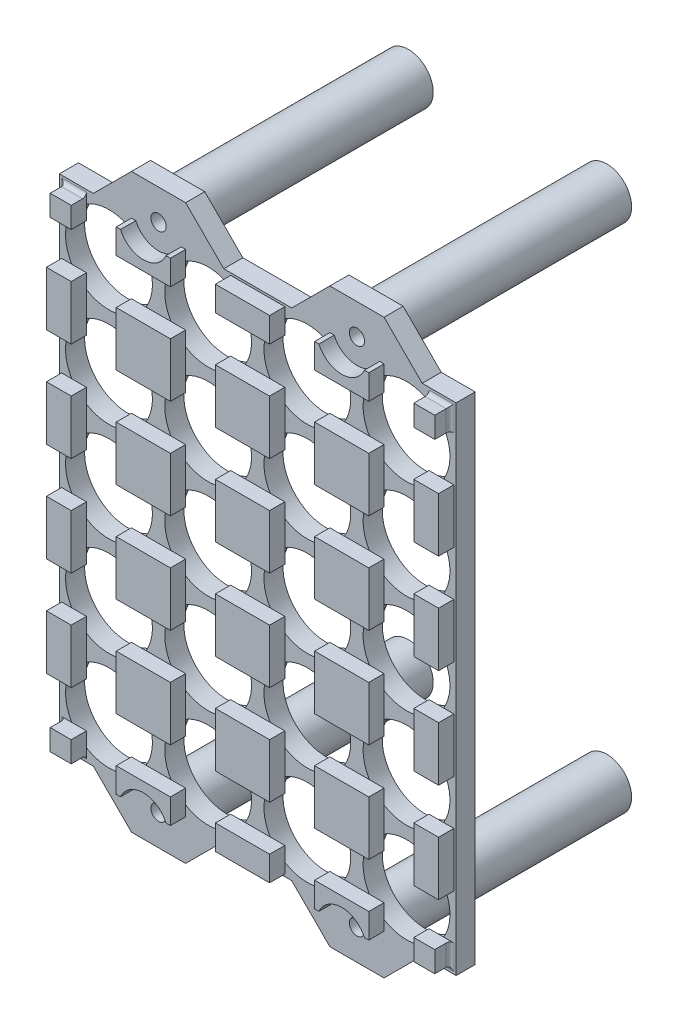
from build123d import *
from build123d.topology import SkipClean

# Parameters (mm, degrees)
SZKIC1_W                         = 104
SZKIC1_H                         = 26
SZKIC1_R                         = 11.376078461
DODANIE_WYCI_GNI_CIE1_DEPTH      = 5
DODANIE_WYCI_GNI_CIE7_START      = 5
SZKIC15_W                        = 5.5
SZKIC15_H                        = 5.5
DODANIE_WYCI_GNI_CIE7_DEPTH      = 4
ZAOKR_GLENIE9_R                  = 1
SZYK_LINIOWY9_COUNT              = 5
SZYK_LINIOWY9_PITCH              = 26
ZAOKR_GLENIE9_OF_SZYK_LINIOWY9_R = 1
SZKIC16_W                        = 14.2
SZKIC16_H                        = 14.2
SZKIC16_H_2                      = 6.5
SZKIC16_W_2                      = 6.5
DODANIE_WYCI_GNI_CIE8_DEPTH      = 4
SZKIC17_W                        = 14.2
SZKIC17_H                        = 5
DODANIE_WYCI_GNI_CIE9_DEPTH      = 10
SZKIC19_R                        = 6.5
SZKIC19_R_2                      = 2
DODANIE_WYCI_GNI_CIE10_DEPTH     = 60.5
WYTNIJ_WYCI_GNI_CIE2_START       = -10
SZKIC19_4_R                      = 2
WYTNIJ_WYCI_GNI_CIE2_DEPTH       = 10
WYTNIJ_WYCI_GNI_CIE4_START       = -15
SZKIC19_6_R                      = 6.5
WYTNIJ_WYCI_GNI_CIE4_DEPTH       = 10
SFAZOWANIE2_SIZE                 = 10
SFAZOWANIE3_SIZE                 = 10


with BuildPart() as part:
    # Szkic1 → Dodanie-wyciągnięcie1 (new body)
    with BuildSketch(Plane.XY):
        with Locations((31.794588102, -4.944794966)):
            Rectangle(SZKIC1_W, SZKIC1_H)
        with Locations((-7.205411898, -4.944794966)):
            Circle(SZKIC1_R, mode=Mode.SUBTRACT)
        with Locations((18.794588102, -4.944794966)):
            Circle(SZKIC1_R, mode=Mode.SUBTRACT)
        with Locations((44.794588102, -4.944794966)):
            Circle(SZKIC1_R, mode=Mode.SUBTRACT)
        with Locations((70.794588102, -4.944794966)):
            Circle(SZKIC1_R, mode=Mode.SUBTRACT)
    dodanie_wyci_gni_cie1 = extrude(amount=DODANIE_WYCI_GNI_CIE1_DEPTH)

    # Szkic15 → Dodanie-wyciągnięcie7 (add)
    with BuildSketch(Plane.XY.offset(DODANIE_WYCI_GNI_CIE7_START)):
        with Locations((-15.855411898, 3.705205034)):
            Rectangle(SZKIC15_W, SZKIC15_H)
        with Locations((1.444588102, 3.705205034)):
            Rectangle(SZKIC15_W, SZKIC15_H)
        with Locations((10.144588102, 3.705205034)):
            Rectangle(SZKIC15_W, SZKIC15_H)
        with Locations((27.444588102, 3.705205034)):
            Rectangle(SZKIC15_W, SZKIC15_H)
        with Locations((36.144588102, 3.705205034)):
            Rectangle(SZKIC15_W, SZKIC15_H)
        with Locations((53.444588102, 3.705205034)):
            Rectangle(SZKIC15_W, SZKIC15_H)
        with Locations((62.144588102, 3.705205034)):
            Rectangle(SZKIC15_W, SZKIC15_H)
        with Locations((79.444588102, 3.705205034)):
            Rectangle(SZKIC15_W, SZKIC15_H)
        with Locations((79.444588102, -13.594794966)):
            Rectangle(SZKIC15_W, SZKIC15_H)
        with Locations((62.144588102, -13.594794966)):
            Rectangle(SZKIC15_W, SZKIC15_H)
        with Locations((53.444588102, -13.594794966)):
            Rectangle(SZKIC15_W, SZKIC15_H)
        with Locations((36.144588102, -13.594794966)):
            Rectangle(SZKIC15_W, SZKIC15_H)
        with Locations((27.444588102, -13.594794966)):
            Rectangle(SZKIC15_W, SZKIC15_H)
        with Locations((10.144588102, -13.594794966)):
            Rectangle(SZKIC15_W, SZKIC15_H)
        with Locations((1.444588102, -13.594794966)):
            Rectangle(SZKIC15_W, SZKIC15_H)
        with Locations((-15.855411898, -13.594794966)):
            Rectangle(SZKIC15_W, SZKIC15_H)
    dodanie_wyci_gni_cie7 = extrude(amount=DODANIE_WYCI_GNI_CIE7_DEPTH)

    # Zaokrąglenie9
    zaokr_glenie9_edges = [part.edges().sort_by_distance(p)[0] for p in [
        (10.144588102, 6.455205034, 5),
        (7.394588102, 3.705205034, 5),
        (1.444588102, -16.344794966, 5),
        (4.194588102, -13.594794966, 5),
        (53.444588102, -16.344794966, 5),
        (56.194588102, -13.594794966, 5),
        (79.444588102, 6.455205034, 5),
        (82.194588102, 3.705205034, 5),
        (79.444588102, -16.344794966, 5),
        (82.194588102, -13.594794966, 5),
        (62.144588102, -16.344794966, 5),
        (59.394588102, -13.594794966, 5),
        (62.144588102, 6.455205034, 5),
        (59.394588102, 3.705205034, 5),
        (53.444588102, 6.455205034, 5),
        (56.194588102, 3.705205034, 5),
        (27.444588102, -16.344794966, 5),
        (30.194588102, -13.594794966, 5),
        (-15.855411898, -16.344794966, 5),
        (-18.605411898, -13.594794966, 5),
        (36.144588102, -16.344794966, 5),
        (33.394588102, -13.594794966, 5),
        (36.144588102, 6.455205034, 5),
        (33.394588102, 3.705205034, 5),
        (27.444588102, 6.455205034, 5),
        (30.194588102, 3.705205034, 5),
        (10.144588102, -16.344794966, 5),
        (7.394588102, -13.594794966, 5),
        (-15.855411898, 6.455205034, 5),
        (-18.605411898, 3.705205034, 5),
        (1.444588102, 6.455205034, 5),
        (4.194588102, 3.705205034, 5),
    ]]
    fillet(zaokr_glenie9_edges, radius=ZAOKR_GLENIE9_R)

    # Szyk liniowy9: Dodanie-wyciągnięcie1, Dodanie-wyciągnięcie7 ×5
    with Locations(*[(0, i * SZYK_LINIOWY9_PITCH, 0) for i in range(1, SZYK_LINIOWY9_COUNT)]):
        add(dodanie_wyci_gni_cie1)
        add(dodanie_wyci_gni_cie7)

    # Zaokrąglenie9 of Szyk liniowy9
    zaokr_glenie9_of_szyk_liniowy9_edges = [part.edges().sort_by_distance(p)[0] for p in [
        (10.144588102, 32.455205034, 5),
        (7.394588102, 29.705205034, 5),
        (1.444588102, 9.655205034, 5),
        (4.194588102, 12.405205034, 5),
        (53.444588102, 9.655205034, 5),
        (56.194588102, 12.405205034, 5),
        (79.444588102, 32.455205034, 5),
        (82.194588102, 29.705205034, 5),
        (79.444588102, 9.655205034, 5),
        (82.194588102, 12.405205034, 5),
        (62.144588102, 9.655205034, 5),
        (59.394588102, 12.405205034, 5),
        (62.144588102, 32.455205034, 5),
        (59.394588102, 29.705205034, 5),
        (53.444588102, 32.455205034, 5),
        (56.194588102, 29.705205034, 5),
        (27.444588102, 9.655205034, 5),
        (30.194588102, 12.405205034, 5),
        (-15.855411898, 9.655205034, 5),
        (-18.605411898, 12.405205034, 5),
        (36.144588102, 9.655205034, 5),
        (33.394588102, 12.405205034, 5),
        (36.144588102, 32.455205034, 5),
        (33.394588102, 29.705205034, 5),
        (27.444588102, 32.455205034, 5),
        (30.194588102, 29.705205034, 5),
        (10.144588102, 9.655205034, 5),
        (7.394588102, 12.405205034, 5),
        (-15.855411898, 32.455205034, 5),
        (-18.605411898, 29.705205034, 5),
        (1.444588102, 32.455205034, 5),
        (4.194588102, 29.705205034, 5),
        (10.144588102, 58.455205034, 5),
        (7.394588102, 55.705205034, 5),
        (1.444588102, 35.655205034, 5),
        (4.194588102, 38.405205034, 5),
        (53.444588102, 35.655205034, 5),
        (56.194588102, 38.405205034, 5),
        (79.444588102, 58.455205034, 5),
        (82.194588102, 55.705205034, 5),
        (79.444588102, 35.655205034, 5),
        (82.194588102, 38.405205034, 5),
        (62.144588102, 35.655205034, 5),
        (59.394588102, 38.405205034, 5),
        (62.144588102, 58.455205034, 5),
        (59.394588102, 55.705205034, 5),
        (53.444588102, 58.455205034, 5),
        (56.194588102, 55.705205034, 5),
        (27.444588102, 35.655205034, 5),
        (30.194588102, 38.405205034, 5),
        (-15.855411898, 35.655205034, 5),
        (-18.605411898, 38.405205034, 5),
        (36.144588102, 35.655205034, 5),
        (33.394588102, 38.405205034, 5),
        (36.144588102, 58.455205034, 5),
        (33.394588102, 55.705205034, 5),
        (27.444588102, 58.455205034, 5),
        (30.194588102, 55.705205034, 5),
        (10.144588102, 35.655205034, 5),
        (7.394588102, 38.405205034, 5),
        (-15.855411898, 58.455205034, 5),
        (-18.605411898, 55.705205034, 5),
        (1.444588102, 58.455205034, 5),
        (4.194588102, 55.705205034, 5),
        (10.144588102, 84.455205034, 5),
        (7.394588102, 81.705205034, 5),
        (1.444588102, 61.655205034, 5),
        (4.194588102, 64.405205034, 5),
        (53.444588102, 61.655205034, 5),
        (56.194588102, 64.405205034, 5),
        (79.444588102, 84.455205034, 5),
        (82.194588102, 81.705205034, 5),
        (79.444588102, 61.655205034, 5),
        (82.194588102, 64.405205034, 5),
        (62.144588102, 61.655205034, 5),
        (59.394588102, 64.405205034, 5),
        (62.144588102, 84.455205034, 5),
        (59.394588102, 81.705205034, 5),
        (53.444588102, 84.455205034, 5),
        (56.194588102, 81.705205034, 5),
        (27.444588102, 61.655205034, 5),
        (30.194588102, 64.405205034, 5),
        (-15.855411898, 61.655205034, 5),
        (-18.605411898, 64.405205034, 5),
        (36.144588102, 61.655205034, 5),
        (33.394588102, 64.405205034, 5),
        (36.144588102, 84.455205034, 5),
        (33.394588102, 81.705205034, 5),
        (27.444588102, 84.455205034, 5),
        (30.194588102, 81.705205034, 5),
        (10.144588102, 61.655205034, 5),
        (7.394588102, 64.405205034, 5),
        (-15.855411898, 84.455205034, 5),
        (-18.605411898, 81.705205034, 5),
        (1.444588102, 84.455205034, 5),
        (4.194588102, 81.705205034, 5),
        (10.144588102, 110.455205034, 5),
        (7.394588102, 107.705205034, 5),
        (1.444588102, 87.655205034, 5),
        (4.194588102, 90.405205034, 5),
        (53.444588102, 87.655205034, 5),
        (56.194588102, 90.405205034, 5),
        (79.444588102, 110.455205034, 5),
        (82.194588102, 107.705205034, 5),
        (79.444588102, 87.655205034, 5),
        (82.194588102, 90.405205034, 5),
        (62.144588102, 87.655205034, 5),
        (59.394588102, 90.405205034, 5),
        (62.144588102, 110.455205034, 5),
        (59.394588102, 107.705205034, 5),
        (53.444588102, 110.455205034, 5),
        (56.194588102, 107.705205034, 5),
        (27.444588102, 87.655205034, 5),
        (30.194588102, 90.405205034, 5),
        (-15.855411898, 87.655205034, 5),
        (-18.605411898, 90.405205034, 5),
        (36.144588102, 87.655205034, 5),
        (33.394588102, 90.405205034, 5),
        (36.144588102, 110.455205034, 5),
        (33.394588102, 107.705205034, 5),
        (27.444588102, 110.455205034, 5),
        (30.194588102, 107.705205034, 5),
        (10.144588102, 87.655205034, 5),
        (7.394588102, 90.405205034, 5),
        (-15.855411898, 110.455205034, 5),
        (-18.605411898, 107.705205034, 5),
        (1.444588102, 110.455205034, 5),
        (4.194588102, 107.705205034, 5),
    ]]
    fillet(zaokr_glenie9_of_szyk_liniowy9_edges, radius=ZAOKR_GLENIE9_OF_SZYK_LINIOWY9_R)

    # Szkic16 → Dodanie-wyciągnięcie8 (add)
    with BuildSketch(Plane.XY.offset(5)):
        with Locations((5.794588102, 86.055205034)):
            Rectangle(SZKIC16_W, SZKIC16_H)
        with Locations((31.794588102, 86.055205034)):
            Rectangle(SZKIC16_W, SZKIC16_H)
        with Locations((57.794588102, 86.055205034)):
            Rectangle(SZKIC16_W, SZKIC16_H)
        with Locations((5.794588102, 60.055205034)):
            Rectangle(SZKIC16_W, SZKIC16_H)
        with Locations((31.794588102, 60.055205034)):
            Rectangle(SZKIC16_W, SZKIC16_H)
        with Locations((57.794588102, 60.055205034)):
            Rectangle(SZKIC16_W, SZKIC16_H)
        with Locations((57.794588102, 34.055205034)):
            Rectangle(SZKIC16_W, SZKIC16_H)
        with Locations((31.794588102, 34.055205034)):
            Rectangle(SZKIC16_W, SZKIC16_H)
        with Locations((5.794588102, 34.055205034)):
            Rectangle(SZKIC16_W, SZKIC16_H)
        with Locations((5.794588102, 8.055205034)):
            Rectangle(SZKIC16_W, SZKIC16_H)
        with Locations((31.794588102, 8.055205034)):
            Rectangle(SZKIC16_W, SZKIC16_H)
        with Locations((57.794588102, 8.055205034)):
            Rectangle(SZKIC16_W, SZKIC16_H)
        with Locations((5.794588102, 108.205205034)):
            Rectangle(SZKIC16_W, SZKIC16_H_2)
        with Locations((31.794588102, 108.205205034)):
            Rectangle(SZKIC16_W, SZKIC16_H_2)
        with Locations((57.794588102, 108.205205034)):
            Rectangle(SZKIC16_W, SZKIC16_H_2)
        with Locations((79.944588102, 86.055205034)):
            Rectangle(SZKIC16_W_2, SZKIC16_H)
        with Locations((79.944588102, 60.055205034)):
            Rectangle(SZKIC16_W_2, SZKIC16_H)
        with Locations((79.944588102, 34.055205034)):
            Rectangle(SZKIC16_W_2, SZKIC16_H)
        with Locations((79.944588102, 8.055205034)):
            Rectangle(SZKIC16_W_2, SZKIC16_H)
        with Locations((57.794588102, -14.094794966)):
            Rectangle(SZKIC16_W, SZKIC16_H_2)
        with Locations((31.794588102, -14.094794966)):
            Rectangle(SZKIC16_W, SZKIC16_H_2)
        with Locations((5.794588102, -14.094794966)):
            Rectangle(SZKIC16_W, SZKIC16_H_2)
        with Locations((-16.355411898, 8.055205034)):
            Rectangle(SZKIC16_W_2, SZKIC16_H)
        with Locations((-16.355411898, 34.055205034)):
            Rectangle(SZKIC16_W_2, SZKIC16_H)
        with Locations((-16.355411898, 60.055205034)):
            Rectangle(SZKIC16_W_2, SZKIC16_H)
        with Locations((-16.355411898, 86.055205034)):
            Rectangle(SZKIC16_W_2, SZKIC16_H)
    extrude(amount=DODANIE_WYCI_GNI_CIE8_DEPTH)

    # Szkic17 → Dodanie-wyciągnięcie9 (add)
    with BuildSketch(Plane(origin=(0, 112.055205034, 0), x_dir=(1, 0, 0), z_dir=(0, 1, 0))):
        with Locations((5.794588102, -2.5)):
            Rectangle(SZKIC17_W, SZKIC17_H)
        with Locations((57.794588102, -2.5)):
            Rectangle(SZKIC17_W, SZKIC17_H)
    dodanie_wyci_gni_cie9 = extrude(amount=DODANIE_WYCI_GNI_CIE9_DEPTH)

    # Szkic19 → Dodanie-wyciągnięcie10 (add)
    # profile 1 of 5: a face of its own
    with BuildSketch(Plane(origin=(0, 0, 0), x_dir=(-1, 0, 0), z_dir=(0, 0, -1))):
        with BuildLine():
            ThreePointArc((-51.294588102, 114.055205034), (-53.198394025, 118.651399111), (-57.794588102, 120.555205034))
            Line((-57.794588102, 120.555205034), (-57.794588102, 116.055205034))
            ThreePointArc((-57.794588102, 116.055205034), (-56.38037454, 115.469418596), (-55.794588102, 114.055205034))
            ThreePointArc((-55.794588102, 114.055205034), (-56.38037454, 112.640991471), (-57.794588102, 112.055205034))
            Line((-57.794588102, 112.055205034), (-57.794588102, 107.555205034))
            ThreePointArc((-57.794588102, 107.555205034), (-53.198394025, 109.459010956), (-51.294588102, 114.055205034))
        make_face()
    # profile 2 of 5: a face of its own
    with BuildSketch(Plane(origin=(0, 0, 0), x_dir=(-1, 0, 0), z_dir=(0, 0, -1))):
        with BuildLine():
            Line((-57.794588102, 116.055205034), (-57.794588102, 120.555205034))
            ThreePointArc((-57.794588102, 120.555205034), (-64.294588102, 114.055205034), (-57.794588102, 107.555205034))
            Line((-57.794588102, 107.555205034), (-57.794588102, 112.055205034))
            ThreePointArc((-57.794588102, 112.055205034), (-59.794588102, 114.055205034), (-57.794588102, 116.055205034))
        make_face()
    # profile 3 of 5: a face of its own
    with BuildSketch(Plane(origin=(0, 0, 0), x_dir=(-1, 0, 0), z_dir=(0, 0, -1))):
        with BuildLine():
            ThreePointArc((-51.294588102, 114.055205034), (-53.198394025, 118.651399111), (-57.794588102, 120.555205034))
            Line((-57.794588102, 120.555205034), (-57.794588102, 116.055205034))
            ThreePointArc((-57.794588102, 116.055205034), (-56.38037454, 115.469418596), (-55.794588102, 114.055205034))
            ThreePointArc((-55.794588102, 114.055205034), (-56.38037454, 112.640991471), (-57.794588102, 112.055205034))
            Line((-57.794588102, 112.055205034), (-57.794588102, 107.555205034))
            ThreePointArc((-57.794588102, 107.555205034), (-53.198394025, 109.459010956), (-51.294588102, 114.055205034))
        make_face()
    # profile 4 of 5: a face of its own
    with BuildSketch(Plane(origin=(0, 0, 0), x_dir=(-1, 0, 0), z_dir=(0, 0, -1))):
        with BuildLine():
            Line((-57.794588102, 116.055205034), (-57.794588102, 120.555205034))
            ThreePointArc((-57.794588102, 120.555205034), (-64.294588102, 114.055205034), (-57.794588102, 107.555205034))
            Line((-57.794588102, 107.555205034), (-57.794588102, 112.055205034))
            ThreePointArc((-57.794588102, 112.055205034), (-59.794588102, 114.055205034), (-57.794588102, 116.055205034))
        make_face()
    # profile 5 of 5: a face of its own
    with BuildSketch(Plane(origin=(0, 0, 0), x_dir=(-1, 0, 0), z_dir=(0, 0, -1))):
        with Locations((-5.794588102, 114.055205034)):
            Circle(SZKIC19_R)
        with Locations(Location((-5.794588102, 114.055205034, 0), (0, 0, 180))):
            Circle(SZKIC19_R_2, mode=Mode.SUBTRACT)
    dodanie_wyci_gni_cie10 = extrude(amount=DODANIE_WYCI_GNI_CIE10_DEPTH)

    # Szkic19<4> → Wytnij-wyciągnięcie2 (cut)
    with SkipClean():  # the faces are left unmerged after this step: merging them gives an invalid solid
        with BuildSketch(Plane(origin=(0, 0, 0), x_dir=(-1, 0, 0), z_dir=(0, 0, -1)).offset(WYTNIJ_WYCI_GNI_CIE2_START)):
            with Locations(Location((-57.794588102, 114.055205034, 0), (0, 0, 180))):
                Circle(SZKIC19_4_R)
            with Locations(Location((-5.794588102, 114.055205034, 0), (0, 0, 180))):
                Circle(SZKIC19_4_R)
        wytnij_wyci_gni_cie2 = extrude(amount=WYTNIJ_WYCI_GNI_CIE2_DEPTH, mode=Mode.SUBTRACT)

    # Szkic19<6> → Wytnij-wyciągnięcie4 (cut)
    with SkipClean():  # the faces are left unmerged after this step: merging them gives an invalid solid
        with BuildSketch(Plane(origin=(0, 0, 0), x_dir=(-1, 0, 0), z_dir=(0, 0, -1)).offset(WYTNIJ_WYCI_GNI_CIE4_START)):
            with Locations(Location((-57.794588102, 114.055205034, 0), (0, 0, 180))):
                Circle(SZKIC19_6_R)
            with Locations((-5.794588102, 114.055205034)):
                Circle(SZKIC19_6_R)
        wytnij_wyci_gni_cie4 = extrude(amount=WYTNIJ_WYCI_GNI_CIE4_DEPTH, mode=Mode.SUBTRACT)

    # Lustro11: Dodanie-wyciągnięcie9, Dodanie-wyciągnięcie10, Wytnij-wyciągnięcie2, Wytnij-wyciągnięcie4 across plane
    with SkipClean():  # the faces are left unmerged after this step: merging them gives an invalid solid
        add(dodanie_wyci_gni_cie9.mirror(Plane.ZX.offset(47.055205034)))
        add(dodanie_wyci_gni_cie10.mirror(Plane.ZX.offset(47.055205034)))
        add(wytnij_wyci_gni_cie2.mirror(Plane.ZX.offset(47.055205034)), mode=Mode.SUBTRACT)
        add(wytnij_wyci_gni_cie4.mirror(Plane.ZX.offset(47.055205034)), mode=Mode.SUBTRACT)

    # Sfazowanie2
    sfazowanie2_edges = [part.edges().sort_by_distance(p)[0] for p in [
        (64.894588102, -17.944794966, 2.5),
        (50.694588102, -17.944794966, 2.5),
        (-1.305411898, -17.944794966, 2.5),
        (-1.305411898, 112.055205034, 2.5),
        (12.894588102, 112.055205034, 2.5),
        (50.694588102, 112.055205034, 2.5),
        (64.894588102, 112.055205034, 2.5),
    ]]
    chamfer(sfazowanie2_edges, length=SFAZOWANIE2_SIZE - 0.0001)  # a hair under: the kernel refuses the full size

    # Sfazowanie3
    sfazowanie3_edges = [part.edges().sort_by_distance(p)[0] for p in [
        (12.894588102, -17.944794966, 2.5),
    ]]
    chamfer(sfazowanie3_edges, length=SFAZOWANIE3_SIZE - 0.0001)  # a hair under: the kernel refuses the full size


solid = part.part
